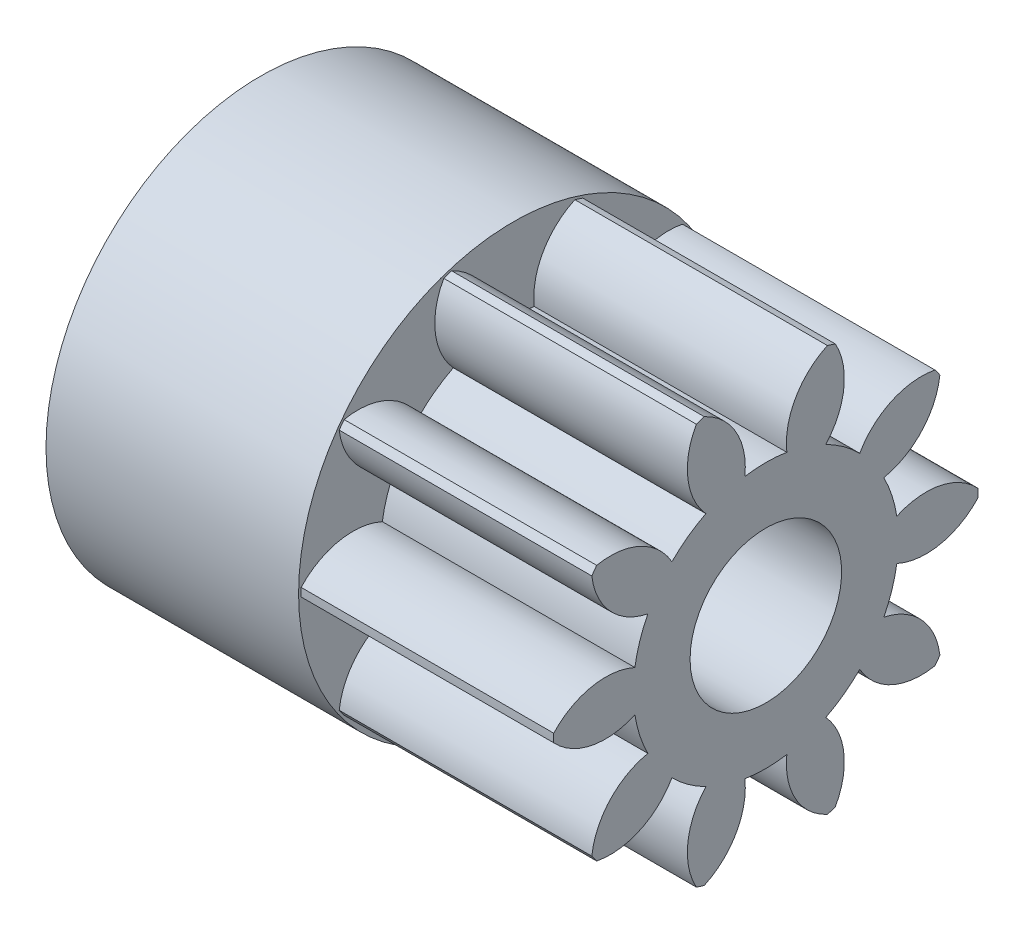
from build123d import *

# Parameters (mm, degrees)
BASPROSKE_W             = 5
BASPROSKE_H             = 4.2
TOOTHCUT_DEPTH          = 8.764019578
TEETHCUTS_COUNT         = 10
TEETHCUTS_ANGLE         = 324
BORSKE_R                = 1.5
BORE_DEPTH              = 50.0000508
CROQUIS1_R              = 4.25
CROQUIS1_R_2            = 3.25
SALIENTE_EXTRUIR1_DEPTH = 5
CROQUIS2_R              = 3.25
SALIENTE_EXTRUIR2_DEPTH = 2
SALIENTE_EXTRUIR3_DEPTH = 2


with BuildPart() as part:
    # BasProSke → Base-Revolve (revolve)
    with BuildSketch(Plane(origin=(0, 0, 0), x_dir=(1, 0, 0), z_dir=(0, 1, 0))):
        with Locations((2.5, 2.1)):
            Rectangle(BASPROSKE_W, BASPROSKE_H)
    revolve(axis=Axis((-10, 0, 0), (1, 0, 0)))

    # TooCutSke → ToothCut (cut, through all)
    with BuildSketch(Plane(origin=(0, 0, 0), x_dir=(0, 0, -1), z_dir=(1, 0, 0))):
        with BuildLine():
            ThreePointArc((0.415506654, 2.590893711), (0, 2.624), (-0.415506654, 2.590893711))
            ThreePointArc((-0.415506654, 2.590893711), (-0.596160737, 3.451685568), (-1.254578949, 4.034852763))
            ThreePointArc((-1.254578949, 4.034852763), (0, 4.2254), (1.254578949, 4.034852763))
            ThreePointArc((1.254578949, 4.034852763), (0.596160737, 3.451685568), (0.415506654, 2.590893711))
        make_face()
    toothcut = extrude(amount=TOOTHCUT_DEPTH, mode=Mode.SUBTRACT)

    # TeethCuts: ToothCut ×10 about axis
    teethcuts_axis = Axis((-10, 0, 0), (1, 0, 0))
    for i in range(1, TEETHCUTS_COUNT):
        add(toothcut.rotate(teethcuts_axis, i * TEETHCUTS_ANGLE / (TEETHCUTS_COUNT - 1)), mode=Mode.SUBTRACT)

    # BorSke → Bore (cut, symmetric)
    with BuildSketch(Plane(origin=(0, 0, 0), x_dir=(0, 0, -1), z_dir=(1, 0, 0))):
        Circle(BORSKE_R)
    extrude(amount=BORE_DEPTH, both=True, mode=Mode.SUBTRACT)

    # Croquis1 → Saliente-Extruir1 (add)
    with BuildSketch(Plane.ZY):
        Circle(CROQUIS1_R)
        Circle(CROQUIS1_R_2, mode=Mode.SUBTRACT)
    extrude(amount=SALIENTE_EXTRUIR1_DEPTH)

    # Croquis2 → Saliente-Extruir2 (add)
    with BuildSketch(Plane.ZY):
        Circle(CROQUIS2_R)
    extrude(amount=SALIENTE_EXTRUIR2_DEPTH)

    # Croquis3 → Saliente-Extruir3 (add)
    with BuildSketch(Plane.ZY.offset(2)):
        with BuildLine():
            Line((-1.95, 2.6), (-1.95, -2.6))
            ThreePointArc((-1.95, -2.6), (-3.25, 0), (-1.95, 2.6))
        make_face()
    extrude(amount=SALIENTE_EXTRUIR3_DEPTH)


solid = part.part
